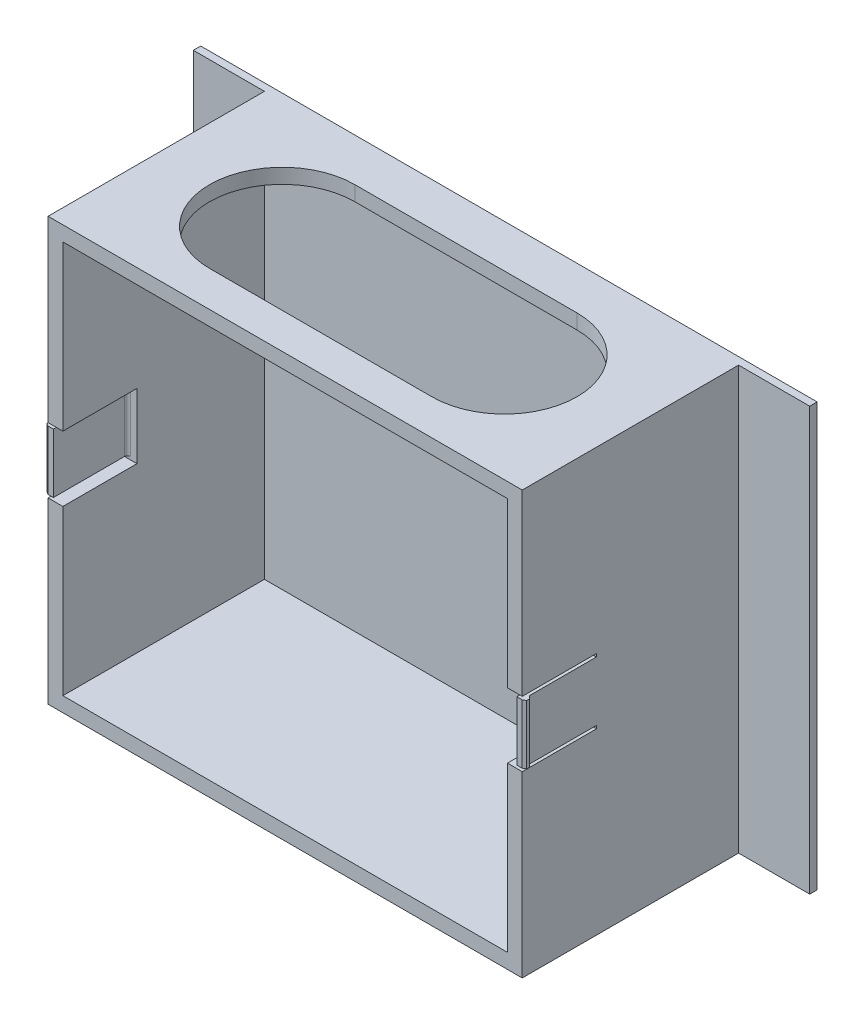
from build123d import *

# Parameters (mm, degrees)
SKETCH2_W            = 203.2
SKETCH2_H            = 92.71
BOSS_EXTRUDE1_DEPTH  = 181.102
SKETCH3_W            = 190.5
SKETCH3_H            = 168.402
CUT_EXTRUDE1_DEPTH   = 86.36
CUT_EXTRUDE2_REACH   = 214.766
SKETCH6_W            = 264.16
SKETCH6_H            = 181.102
BOSS_EXTRUDE2_DEPTH  = 3.175
CUT_EXTRUDE3_DEPTH   = 31.75
FILLET1_R            = 1.27
BOSS_EXTRUDE3_DEPTH  = 12.7
FILLET1_OF_MIRROR1_R = 1.27


with BuildPart() as part:
    # Sketch2 → Boss-Extrude1 (new body)
    with BuildSketch(Plane(origin=(0, 0, 0), x_dir=(1, 0, 0), z_dir=(0, 1, 0))):
        Rectangle(SKETCH2_W, SKETCH2_H)
    extrude(amount=BOSS_EXTRUDE1_DEPTH)

    # Sketch3 → Cut-Extrude1 (cut)
    with BuildSketch(Plane.XY.offset(46.355)):
        with Locations((0, 90.551)):
            Rectangle(SKETCH3_W, SKETCH3_H)
    extrude(amount=-CUT_EXTRUDE1_DEPTH, mode=Mode.SUBTRACT)

    # Sketch5 → Cut-Extrude2 (cut, up to next)
    with BuildSketch(Plane.XZ.offset(-181.102), mode=Mode.PRIVATE) as cut_extrude2_sk1:
        with BuildLine():
            Line((-47.625, 31.115), (47.625, 31.115))
            ThreePointArc((47.625, 31.115), (78.74, 0), (47.625, -31.115))
            Line((47.625, -31.115), (-47.625, -31.115))
            ThreePointArc((-47.625, -31.115), (-78.74, 0), (-47.625, 31.115))
        make_face()
    cut_extrude2_tool1 = extrude(cut_extrude2_sk1.sketch, amount=CUT_EXTRUDE2_REACH, mode=Mode.PRIVATE) & part.part
    add(cut_extrude2_tool1.solids().sort_by_distance((0, 181.102, 0))[0], mode=Mode.SUBTRACT)

    # Sketch6 → Boss-Extrude2 (add)
    with BuildSketch(Plane(origin=(0, 0, -46.355), x_dir=(-1, 0, 0), z_dir=(0, 0, -1))):
        with Locations((0, 90.551)):
            Rectangle(SKETCH6_W, SKETCH6_H)
    extrude(amount=BOSS_EXTRUDE2_DEPTH)

    # Sketch8 → Cut-Extrude3 (cut)
    with BuildSketch(Plane.XY.offset(46.355)):
        Polygon((-101.6, 103.251), (-99.314, 103.251), (-99.314, 77.851), (-101.6, 77.851), (-101.6, 76.581), (-95.25, 76.581), (-95.25, 104.521), (-101.6, 104.521), align=None)
    cut_extrude3 = extrude(amount=-CUT_EXTRUDE3_DEPTH, mode=Mode.SUBTRACT)

    # Fillet1
    fillet1_edges = [part.edges().sort_by_distance(p)[0] for p in [
        (-99.314, 90.551, 14.605),
    ]]
    fillet(fillet1_edges, radius=FILLET1_R)

    # Sketch10 → Boss-Extrude3 (add, symmetric)
    with BuildSketch(Plane(origin=(0, 90.551, 0), x_dir=(-1, 0, 0), z_dir=(0, -1, 0))):
        Polygon((101.6, -46.355), (102.807721606, -45.657721606), (102.807721606, -44.387721606), (101.6, -43.18), align=None)
    boss_extrude3 = extrude(amount=BOSS_EXTRUDE3_DEPTH, both=True)

    # Mirror1: Cut-Extrude3, Boss-Extrude3 across plane
    add(cut_extrude3.mirror(Plane(origin=(0, 0, 0), x_dir=(0, 0, 1), z_dir=(1, 0, 0))), mode=Mode.SUBTRACT)
    add(boss_extrude3.mirror(Plane(origin=(0, 0, 0), x_dir=(0, 0, 1), z_dir=(1, 0, 0))))

    # Fillet1 of Mirror1
    fillet1_of_mirror1_edges = [part.edges().sort_by_distance(p)[0] for p in [
        (99.314, 90.551, 14.605),
    ]]
    fillet(fillet1_of_mirror1_edges, radius=FILLET1_OF_MIRROR1_R)


solid = part.part
